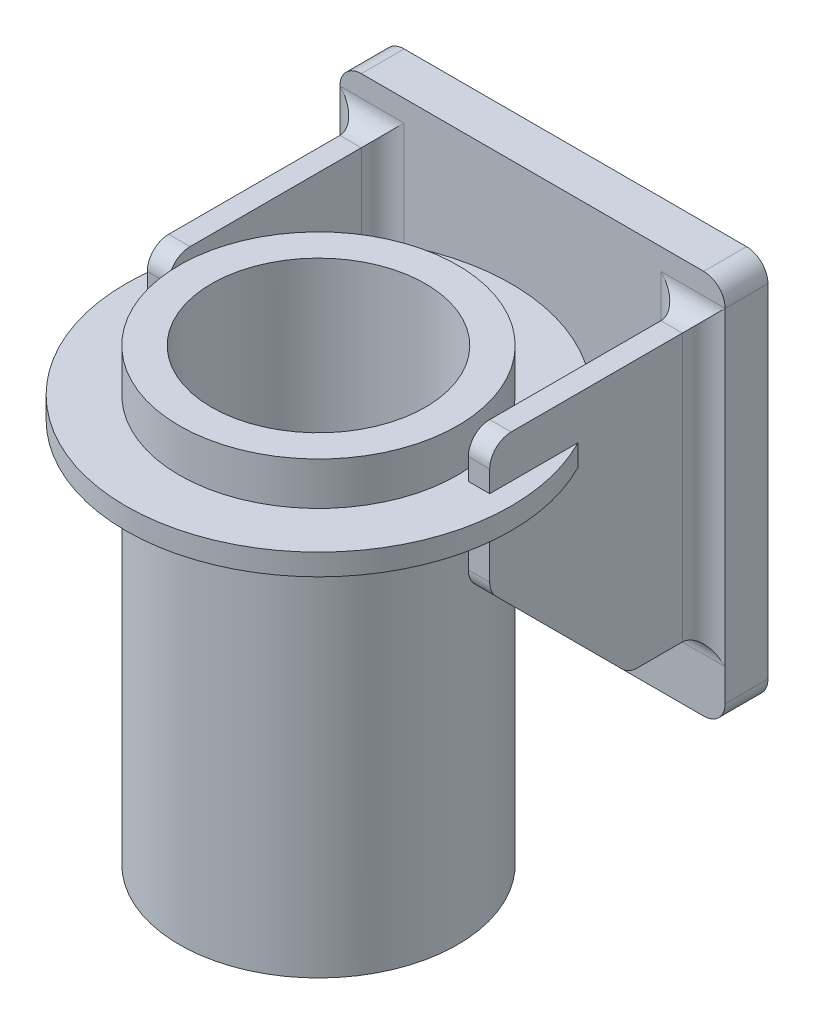
from build123d import *

# Parameters (mm, degrees)
BASE_SKETCH_W                   = 180
BASE_SKETCH_H                   = 180
BASE_EXTRUDE_DEPTH              = 20
SUPPORT_EXTRUDE_DEPTH           = 10
MOTOR_SUPPORT_SKETCH_R          = 90
MOTOR_SUPPORT_EXTRUDE_DEPTH     = 10
MOTOR_SKETCH_R                  = 65
MOTOR_EXTRUDE_DEPTH             = 180
MOTOR_EXTRUDE_DIRECTION_2_REACH = 249.184
MOTOR_HOLE_SKETCH_R             = 50
MOTOR_HOLE_CUT_DEPTH            = 210
SUPPORT_FILLETS_R               = 10


with BuildPart() as part:
    # Base Sketch → Base Extrude (new body)
    with BuildSketch(Plane.XY):
        Rectangle(BASE_SKETCH_W, BASE_SKETCH_H)
    extrude(amount=-BASE_EXTRUDE_DEPTH)

    # Support Sketch → Support Extrude (add)
    with BuildSketch(Plane(origin=(80, 0, 0), x_dir=(0, 0, -1), z_dir=(1, 0, 0))):
        Polygon((-100, 10), (-35, -55), (0, -55), (0, 70), (-100, 70), align=None)
    support_extrude = extrude(amount=-SUPPORT_EXTRUDE_DEPTH)

    # Support Mirror: Support Extrude across plane
    add(support_extrude.mirror(Plane(origin=(0, 0, 0), x_dir=(0, 0, 1), z_dir=(1, 0, 0))))

    # Motor Support Sketch → Motor Support Extrude (add)
    with BuildSketch(Plane(origin=(0, 50, 0), x_dir=(1, 0, 0), z_dir=(0, 1, 0))):
        with Locations((0, -100)):
            Circle(MOTOR_SUPPORT_SKETCH_R)
    extrude(amount=-MOTOR_SUPPORT_EXTRUDE_DEPTH)

    # Motor Sketch → Motor Extrude (add)
    with BuildSketch(Plane.XZ.offset(-40)):
        with Locations(Location((0, 100, 0), (0, 0, 90))):
            Circle(MOTOR_SKETCH_R)
    extrude(amount=MOTOR_EXTRUDE_DEPTH)

    # Motor Extrude direction 2: up to this face of the body (flat: up to its plane)
    motor_extrude_direction_2_end = Plane(part.part.faces().sort_by_distance((75, 70, 50))[0])
    # Motor Sketch → Motor Extrude direction 2 (add, up to the picked face)
    with BuildSketch(Plane.XZ.offset(-40), mode=Mode.PRIVATE) as motor_extrude_direction_2_sk1:
        with Locations(Location((0, 100, 0), (0, 0, 90))):
            Circle(MOTOR_SKETCH_R)
    motor_extrude_direction_2_tool1 = split(extrude(motor_extrude_direction_2_sk1.sketch, amount=-MOTOR_EXTRUDE_DIRECTION_2_REACH, mode=Mode.PRIVATE), bisect_by=motor_extrude_direction_2_end, keep=Keep.BOTH, mode=Mode.PRIVATE)
    add(motor_extrude_direction_2_tool1.solids().sort_by(Axis((0, 40, 100), (0, 1, 0)))[0])

    # Motor Hole Sketch → Motor Hole Cut (cut)
    with BuildSketch(Plane(origin=(0, 70, 0), x_dir=(1, 0, 0), z_dir=(0, 1, 0))):
        with Locations(Location((0, -100, 0), (0, 0, 270))):
            Circle(MOTOR_HOLE_SKETCH_R)
    extrude(amount=-MOTOR_HOLE_CUT_DEPTH, mode=Mode.SUBTRACT)

    # Support Fillets
    support_fillets_edges = [part.edges().sort_by_distance(p)[0] for p in [
        (75, 10, 100),
        (75, 70, 100),
        (70, 7.5, 0),
        (75, 70, 0),
        (75, -55, 0),
        (75, -55, 35),
        (80, 7.5, 0),
        (-75, 70, 100),
        (-75, 10, 100),
        (-75, -55, 35),
        (-80, 7.5, 0),
        (-75, -55, 0),
        (-75, 70, 0),
        (-70, 7.5, 0),
        (90, -90, -10),
        (-90, -90, -10),
        (-90, 90, -10),
        (90, 90, -10),
    ]]
    fillet(support_fillets_edges, radius=SUPPORT_FILLETS_R - 0.0001)  # a hair under: the kernel refuses the full size


solid = part.part
